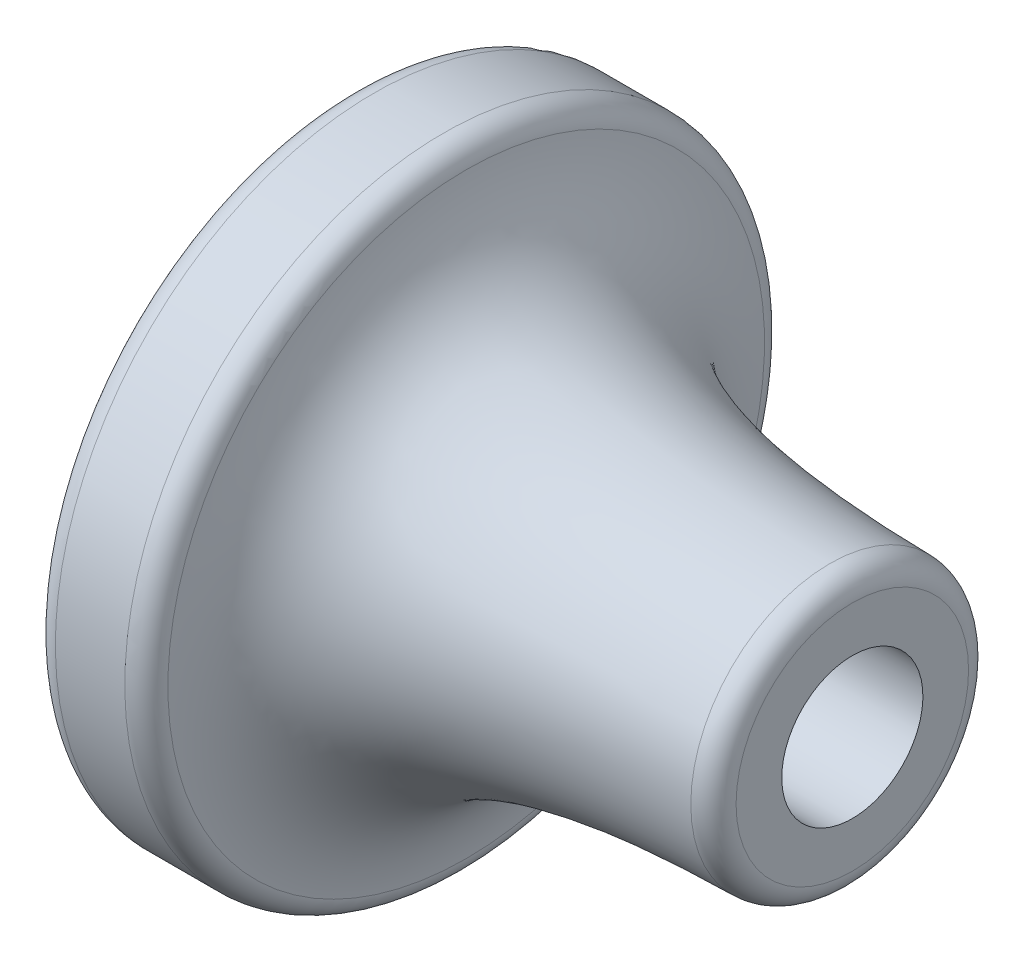
from build123d import *

# Parameters (mm, degrees)
FILLET1_R = 1


with BuildPart() as part:
    # Sketch1 → Revolve1 (revolve)
    with BuildSketch(Plane.XY):
        with BuildLine():
            Line((0, 0), (0, 3.1))
            Line((0, 3.1), (14, 3.1))
            Line((14, 3.1), (14, 6.1))
            add(Edge.make_bspline(
                [(-3, 14), (-3, 8.867369014), (0.961422575, 6.1), (14, 6.1)],
                knots=[0, 0, 0, 0, 1, 1, 1, 1], degree=3))
            Line((-3, 14), (-8, 14))
            Line((-8, 14), (-8, 0))
            Line((-8, 0), (0, 0))
        make_face()
    revolve(axis=Axis((0, 0, 0), (-1, 0, 0)))

    # Fillet1
    fillet1_edges = [part.edges().sort_by_distance(p)[0] for p in [
        (-8, -14, 0),
        (-3, -14, 0),
        (14, -6.1, 0),
    ]]
    fillet(fillet1_edges, radius=FILLET1_R)


solid = part.part
